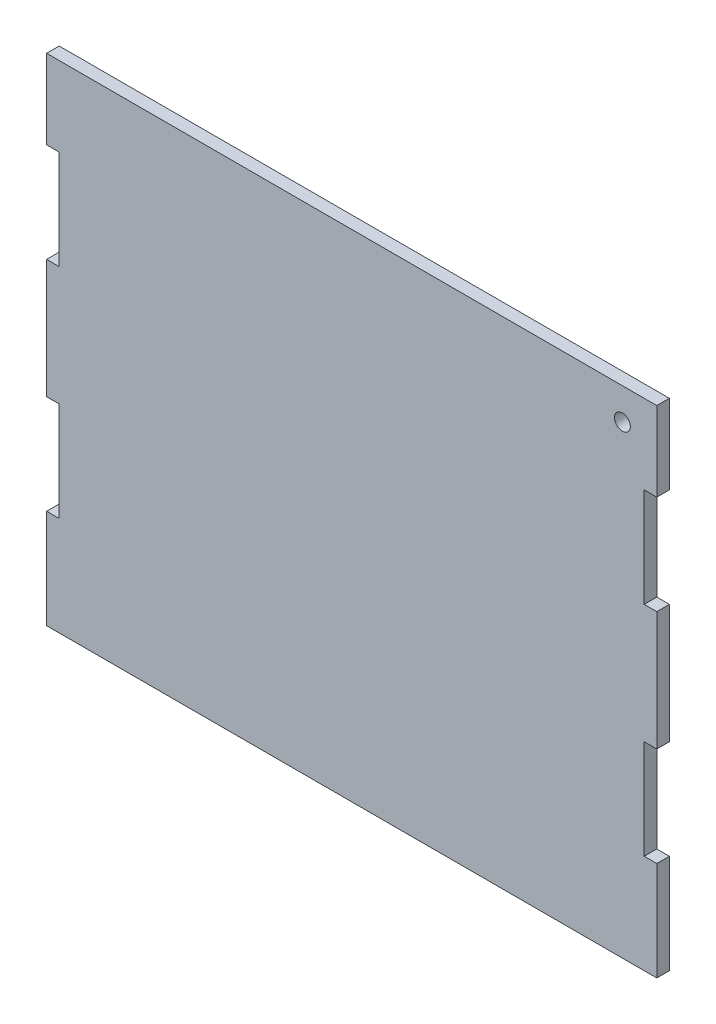
from build123d import *

# Parameters (mm, degrees)
SKETCH1_W           = 307.7
SKETCH1_H           = 250
BOSS_EXTRUDE1_DEPTH = 6.35
SKETCH2_R           = 4
SKETCH2_W           = 6.35
SKETCH2_H           = 50
CUT_EXTRUDE1_DEPTH  = 397.509284254


with BuildPart() as part:
    # Sketch1 → Boss-Extrude1 (new body)
    with BuildSketch(Plane.XY):
        with Locations((153.85, 125)):
            Rectangle(SKETCH1_W, SKETCH1_H)
    extrude(amount=BOSS_EXTRUDE1_DEPTH)

    # Sketch2 → Cut-Extrude1 (cut, through all)
    with BuildSketch(Plane.XY.offset(6.35)):
        with Locations((290.35, 234.125)):
            Circle(SKETCH2_R)
        with Locations((304.525, 75)):
            Rectangle(SKETCH2_W, SKETCH2_H)
        with Locations((304.525, 185)):
            Rectangle(SKETCH2_W, SKETCH2_H)
        with Locations((3.175, 75)):
            Rectangle(SKETCH2_W, SKETCH2_H)
        with Locations((3.175, 185)):
            Rectangle(SKETCH2_W, SKETCH2_H)
    extrude(amount=-CUT_EXTRUDE1_DEPTH, mode=Mode.SUBTRACT)


solid = part.part
